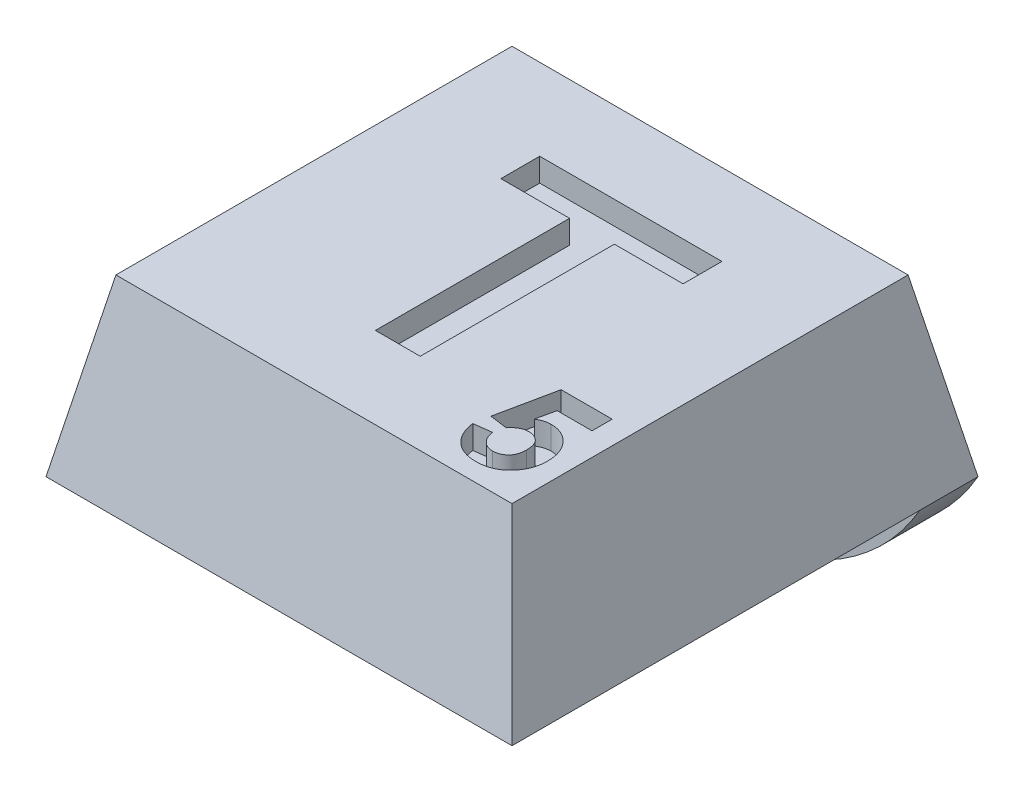
from build123d import *

# Parameters (mm, degrees)
SKETCH1_W               = 8
SKETCH1_H               = 8
BOSS_EXTRUDE1_DEPTH     = 3
CUT_EXTRUDE1_DEPTH      = 12.704699911
CUT_EXTRUDE1_DEPTH_BACK = 12.704699911
CUT_EXTRUDE2_DEPTH      = 11
SKETCH4_R               = 1.8
CUT_EXTRUDE3_DEPTH      = 0.8
SKETCH5_W               = 8
SKETCH5_H               = 1
BOSS_EXTRUDE2_DEPTH     = 2
FILLET1_R               = 4
CUT_EXTRUDE4_DEPTH      = 0.4
CUT_EXTRUDE5_DEPTH      = 0.4


with BuildPart() as part:
    # Sketch1 → Boss-Extrude1 (new body)
    with BuildSketch(Plane(origin=(0, 0, 0), x_dir=(1, 0, 0), z_dir=(0, 1, 0))):
        with Locations((4, 4)):
            Rectangle(SKETCH1_W, SKETCH1_H)
    extrude(amount=BOSS_EXTRUDE1_DEPTH)

    # Sketch2 → Cut-Extrude1 (cut, two sides: drawn at the far end of the back side and taken through both)
    with BuildSketch(Plane.XY.offset(-CUT_EXTRUDE1_DEPTH_BACK)):
        Polygon((0, 0), (0.6, 3), (0, 3), align=None)
        Polygon((8, 0), (7.4, 3), (8, 3), align=None)
    extrude(amount=CUT_EXTRUDE1_DEPTH + CUT_EXTRUDE1_DEPTH_BACK, mode=Mode.SUBTRACT)

    # Sketch3 → Cut-Extrude2 (cut)
    with BuildSketch(Plane(origin=(0, 0, 0), x_dir=(0, 0, -1), z_dir=(1, 0, 0))):
        Polygon((0, 0), (0.6, 3), (0, 3), align=None)
        Polygon((8, 3), (7.4, 3), (8, 0), align=None)
    extrude(amount=CUT_EXTRUDE2_DEPTH, mode=Mode.SUBTRACT)

    # Sketch4 → Cut-Extrude3 (cut)
    with BuildSketch(Plane.XZ):
        with Locations(Location((4, -3.75, 0), (0, 0, 270))):
            Circle(SKETCH4_R)
    extrude(amount=-CUT_EXTRUDE3_DEPTH, mode=Mode.SUBTRACT)

    # Sketch5 → Boss-Extrude2 (add)
    with BuildSketch(Plane.XZ):
        with Locations((4, -7.5)):
            Rectangle(SKETCH5_W, SKETCH5_H)
    extrude(amount=BOSS_EXTRUDE2_DEPTH)

    # Fillet1
    # the kernel refuses this fillet: 4 mm, written as the material it takes off along each edge
    with BuildSketch(Plane(origin=(8, -2, -16.660254038), x_dir=(0, 1, 0), z_dir=(0, 0, 1)), Plane(origin=(0, -2, 1.660254038), x_dir=(0, 1, 0), z_dir=(0, 0, -1))) as fillet1_piece_1:
        with BuildLine():
            CenterArc((4, 3.464101615), FILLET1_R, 180, 60)
            Line((0, 3.464101615), (-0.08, 3.464101615))
            Line((-0.08, 3.464101615), (-0.08, 0))
            Line((-0.08, 0), (0, -0.08))
            ThreePointArc((0, -0.08), (1, -0.08), (1.96, -0.069282032))
            Line((1.96, -0.069282032), (2, 0))
        make_face()
    extrude(amount=18.320508076, mode=Mode.SUBTRACT)

    # Sketch6 → Cut-Extrude4 (cut)
    with BuildSketch(Plane(origin=(0, 3, 0), x_dir=(1, 0, 0), z_dir=(0, 1, 0))):
        Polygon((3.652362984, 2.002856352), (3.652362984, 5.336189685), (2.472875805, 5.336189685), (2.472875805, 6.002856352), (5.601080933, 6.002856352), (5.601080933, 5.336189685), (4.421593754, 5.336189685), (4.421593754, 2.002856352), align=None)
    extrude(amount=-CUT_EXTRUDE4_DEPTH, mode=Mode.SUBTRACT)

    # Sketch7 → Cut-Extrude5 (cut)
    with BuildSketch(Plane(origin=(0, 3, 0), x_dir=(1, 0, 0), z_dir=(0, 1, 0))):
        with BuildLine():
            Line((5.873519392, 1.453659702), (6.173519392, 1.492602009))
            add(Edge.make_bspline(
                [(6.173519392, 1.492602009), (6.1768382, 1.472256976), (6.18322911, 1.433079261), (6.203068429, 1.378384162), (6.230697403, 1.330199963), (6.266205672, 1.289626965), (6.30661854, 1.256629271), (6.351264588, 1.233104776), (6.398791495, 1.218293755), (6.431707248, 1.216554551), (6.448279008, 1.215678932)],
                knots=[0, 0, 0, 0, 1.154848647, 2.223851388, 3.245409892, 4.254330626, 5.232966172, 6.156270698, 7.071756339, 8, 8, 8, 8], degree=3))
            add(Edge.make_bspline(
                [(6.448279008, 1.215678932), (6.457906388, 1.215848075), (6.476752132, 1.216179174), (6.504524052, 1.219937575), (6.531053869, 1.226043662), (6.55659259, 1.234330756), (6.580874213, 1.245230043), (6.603920328, 1.258567919), (6.625817059, 1.274363121), (6.646675237, 1.292223374), (6.665948362, 1.312615024), (6.682055884, 1.336087325), (6.696325112, 1.361440746), (6.707949377, 1.389364059), (6.716328852, 1.41995512), (6.722995329, 1.45269023), (6.726393576, 1.487964606), (6.7270346, 1.51218758), (6.727365546, 1.524693355)],
                knots=[0, 0, 0, 0, 0.981268084, 1.920847364, 2.851509818, 3.754644372, 4.654445699, 5.560569672, 6.465366234, 7.403985617, 8.358004942, 9.316972086, 10.299158387, 11.321223707, 12.392031981, 13.529051644, 14.724304971, 16, 16, 16, 16], degree=3))
            add(Edge.make_bspline(
                [(6.727365546, 1.524693355), (6.727178419, 1.536481523), (6.726816764, 1.559264099), (6.723461454, 1.592272205), (6.718311073, 1.623118586), (6.710117629, 1.651577708), (6.700760071, 1.678178631), (6.688143723, 1.701978526), (6.674300374, 1.724011312), (6.657427434, 1.743088207), (6.639042824, 1.759943867), (6.619463278, 1.774961982), (6.598469004, 1.787493154), (6.576269045, 1.79824857), (6.552478567, 1.806082762), (6.527290541, 1.811294815), (6.501043648, 1.815207497), (6.483029864, 1.815520133), (6.473879969, 1.815678932)],
                knots=[0, 0, 0, 0, 1.29221626, 2.497420946, 3.635005972, 4.715822244, 5.741640361, 6.720139245, 7.663294346, 8.588224307, 9.502291809, 10.395891443, 11.288713187, 12.178904539, 13.095818132, 14.026458458, 14.997562253, 16, 16, 16, 16], degree=3))
            add(Edge.make_bspline(
                [(6.473879969, 1.815678932), (6.462311673, 1.815264192), (6.439232742, 1.814436778), (6.405164091, 1.807710713), (6.372003678, 1.796760631), (6.339785969, 1.781517356), (6.308596201, 1.761859078), (6.278569411, 1.737720606), (6.249190173, 1.70951724), (6.23114374, 1.688207441), (6.2218367, 1.677217394)],
                knots=[0, 0, 0, 0, 0.931687088, 1.85873035, 2.786835662, 3.740075265, 4.723687035, 5.750832598, 6.840042753, 8, 8, 8, 8], degree=3))
            Line((6.2218367, 1.677217394), (5.919673238, 1.719765471))
            Line((5.919673238, 1.719765471), (6.127365546, 2.715678932))
            Line((6.127365546, 2.715678932), (7.004288623, 2.715678932))
            Line((7.004288623, 2.715678932), (7.004288623, 2.369525086))
            Line((7.004288623, 2.369525086), (6.405009777, 2.369525086))
            Line((6.405009777, 2.369525086), (6.3343367, 2.048251048))
            add(Edge.make_bspline(
                [(6.3343367, 2.048251048), (6.352346227, 2.058641979), (6.3874181, 2.078877348), (6.443410579, 2.099707804), (6.499690691, 2.113077126), (6.537629531, 2.114816152), (6.556452085, 2.115678932)],
                knots=[0, 0, 0, 0, 1.060051984, 2.064352337, 3.039669322, 4, 4, 4, 4], degree=3))
            add(Edge.make_bspline(
                [(6.556452085, 2.115678932), (6.574146885, 2.115202759), (6.60910097, 2.114262131), (6.660364054, 2.106544582), (6.709535097, 2.093825268), (6.756780138, 2.076125011), (6.801761249, 2.052924592), (6.844866196, 2.024883357), (6.885472675, 1.991514713), (6.924016987, 1.953782044), (6.959166694, 1.912035385), (6.989521263, 1.866512768), (7.015738821, 1.818347997), (7.037083021, 1.767008911), (7.053155816, 1.712424088), (7.065192785, 1.655063547), (7.07193581, 1.594565079), (7.072984339, 1.553314949), (7.073519392, 1.532265471)],
                knots=[0, 0, 0, 0, 0.974409932, 1.924837087, 2.848242317, 3.768103797, 4.697919751, 5.630842317, 6.595644344, 7.588240789, 8.59876155, 9.595918743, 10.597287627, 11.615415169, 12.652315553, 13.727511434, 14.840374562, 16, 16, 16, 16], degree=3))
            add(Edge.make_bspline(
                [(7.073519392, 1.532265471), (7.073036469, 1.514585649), (7.072077961, 1.479494734), (7.066471429, 1.42756738), (7.056005109, 1.377169317), (7.042672536, 1.328016631), (7.024246745, 1.280521142), (7.002381003, 1.234373213), (6.976242653, 1.189655711), (6.956076521, 1.161441782), (6.945875162, 1.147169317)],
                knots=[0, 0, 0, 0, 1.027524957, 2.039431707, 3.02972907, 4.015954419, 4.995255842, 5.985553205, 6.980960039, 8, 8, 8, 8], degree=3))
            add(Edge.make_bspline(
                [(6.945875162, 1.147169317), (6.931003624, 1.128791302), (6.901734709, 1.092621232), (6.851630217, 1.045066578), (6.797135444, 1.00512898), (6.738397987, 0.97233011), (6.675480422, 0.946591981), (6.608098871, 0.928697649), (6.536747385, 0.917626673), (6.487743367, 0.916337636), (6.462702085, 0.915678932)],
                knots=[0, 0, 0, 0, 1.018121711, 2.003781959, 2.967346956, 3.92281574, 4.896313303, 5.889026666, 6.921282725, 8, 8, 8, 8], degree=3))
            add(Edge.make_bspline(
                [(6.462702085, 0.915678932), (6.442489279, 0.916044029), (6.403022672, 0.9167569), (6.345224712, 0.92380666), (6.290451314, 0.935259909), (6.238356922, 0.95115359), (6.18925085, 0.971795666), (6.142751555, 0.99671717), (6.099246456, 1.026470486), (6.058935891, 1.060830838), (6.021919655, 1.09880899), (5.988902802, 1.140363971), (5.959526451, 1.184800784), (5.934351052, 1.232568443), (5.912895663, 1.28333195), (5.895811978, 1.337351468), (5.881746134, 1.394266746), (5.876291993, 1.433642912), (5.873519392, 1.453659702)],
                knots=[0, 0, 0, 0, 1.098912142, 2.145685936, 3.161086862, 4.139124218, 5.10307886, 6.053641493, 7.003731987, 7.963777669, 8.929946266, 9.883471279, 10.846206077, 11.822909928, 12.81603559, 13.839338588, 14.901632394, 16, 16, 16, 16], degree=3))
        make_face()
    extrude(amount=-CUT_EXTRUDE5_DEPTH, mode=Mode.SUBTRACT)


solid = part.part
